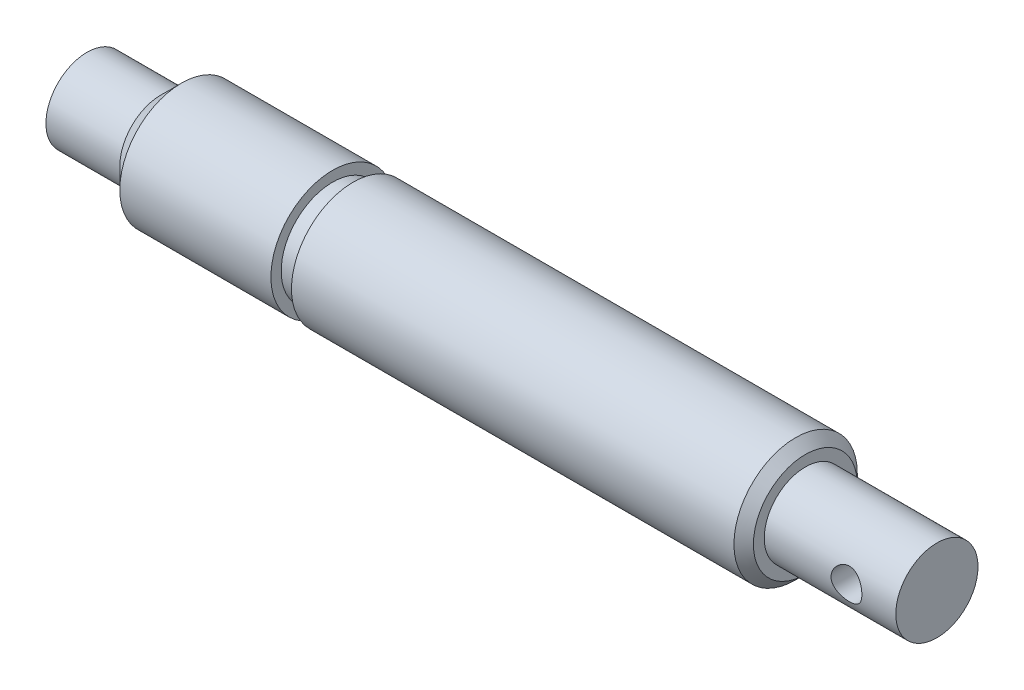
from build123d import *

# Parameters (mm, degrees)
CUT_EXTRUDE_1_DEPTH      = 86.422479477
CUT_EXTRUDE_1_DEPTH_BACK = 86.422479477
SKETCH_3_R               = 1.5
CHAMFER_1_SIZE           = 2


# Read off the part's stored shape, not the designer's step: M12 机械螺纹 螺柱1
with BuildPart() as part:
    # 草图1 → 旋转1 (revolve)
    with BuildSketch(Plane.XY, mode=Mode.PRIVATE) as revolve_1_sk:
        Polygon((0, 0), (2.309401077, 4), (9.5, 4), (9.5, 6), (26.2, 6), (26.2, 5), (28.2, 5), (28.2, 6), (72.2, 6), (72.2, 4), (85, 4), (85, 0), align=None)
    revolve(revolve_1_sk.sketch.rotate(Axis((85, 0, 0), (-1, 0, 0)), 90), axis=Axis((85, 0, 0), (-1, 0, 0)))

    # M12 机械螺纹 螺柱1 outline → M12 机械螺纹 螺柱1 (revolve, cut)
    with BuildSketch(Plane.YX):
        Polygon((6, 72.2), (5.053, 72.2), (6, 71.253), align=None)
    revolve(axis=Axis((0, 0, 0), (1, 0, 0)), mode=Mode.SUBTRACT)

    # 草图3 → 切除-拉伸1 (cut, two sides: drawn at the far end of the back side and taken through both)
    with BuildSketch(Plane.XY.offset(-CUT_EXTRUDE_1_DEPTH_BACK)):
        with Locations((80.2, 0)):
            Circle(SKETCH_3_R)
    extrude(amount=CUT_EXTRUDE_1_DEPTH + CUT_EXTRUDE_1_DEPTH_BACK, mode=Mode.SUBTRACT)

    # 倒角1
    chamfer_1_edges = [part.edges().sort_by_distance(p)[0] for p in [
        (9.5, 0, 6),
    ]]
    chamfer(chamfer_1_edges, length=CHAMFER_1_SIZE - 0.0001)  # a hair under: the kernel refuses the full size


solid = part.part
